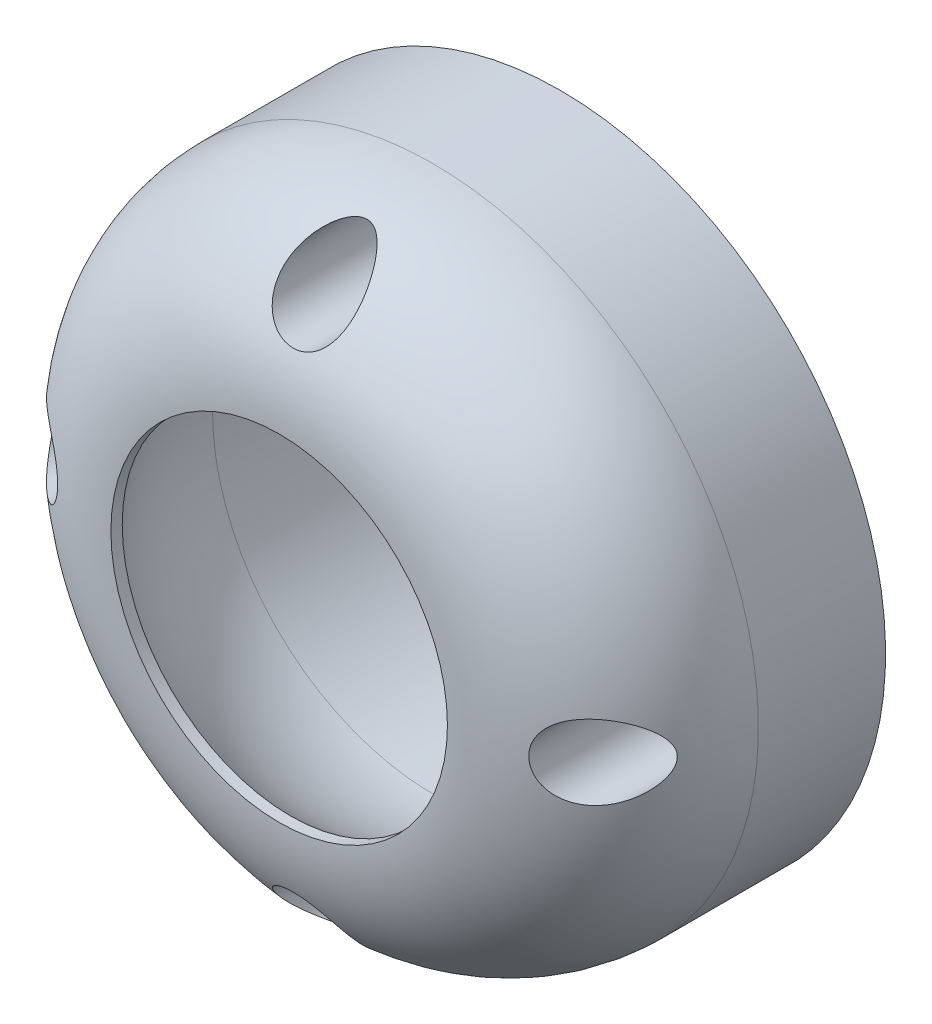
from build123d import *

# Parameters (mm, degrees)
REVOLVE_1_ANGLE     = 180
SKETCH_2_R          = 11.25
CUT_EXTRUDE_1_DEPTH = 27.413774815
SKETCH_3_R          = 21.75
SKETCH_3_R_2        = 14.75
EXTRUDE_1_DEPTH     = 8.5
SKETCH_7_R          = 1.1
CUT_EXTRUDE_2_DEPTH = 37.048238436
CUT_EXTRUDE_START   = 3
SKETCH_8_R          = 2.5
CUT_EXTRUDE_7_DEPTH = 34.048238436


with BuildPart() as part:
    # ｽｹｯﾁ1 → 回転1 (revolve)
    with BuildSketch(Plane.XY):
        with BuildLine():
            Line((-15.25, 0), (-14.75, 0))
            ThreePointArc((-14.75, 0), (0, -14.75), (14.75, 0))
            Line((14.75, 0), (15.25, 0))
            ThreePointArc((15.25, 0), (0, -15.25), (-15.25, 0))
        make_face()
    revolve(axis=Axis((14.75, 0, 0), (-1, 0, 0)), revolution_arc=REVOLVE_1_ANGLE)

    # ｽｹｯﾁ2 → ｶｯﾄ - 押し出し1 (cut, through all)
    with BuildSketch(Plane(origin=(0, 0, 0), x_dir=(-1, 0, 0), z_dir=(0, 0, -1))):
        Circle(SKETCH_2_R)
    extrude(amount=-CUT_EXTRUDE_1_DEPTH, mode=Mode.SUBTRACT)

    # ｽｹｯﾁ4 → 回転2 (revolve)
    with BuildSketch(Plane(origin=(0, 0, 0), x_dir=(0, 0, -1), z_dir=(1, 0, 0))):
        with BuildLine():
            Line((0, 15.25), (0, 21.75))
            ThreePointArc((0, 21.75), (-7.352720585, 18.661989683), (-10.295630141, 11.25))
            ThreePointArc((-10.295630141, 11.25), (-5.522680509, 14.214868976), (0, 15.25))
        make_face()
    revolve(axis=Axis((0, 0, 0), (0, 0, 1)))

    # ｽｹｯﾁ3 → ﾎﾞｽ - 押し出し1 (add)
    with BuildSketch(Plane(origin=(0, 0, 0), x_dir=(-1, 0, 0), z_dir=(0, 0, -1))):
        Circle(SKETCH_3_R)
        Circle(SKETCH_3_R_2, mode=Mode.SUBTRACT)
    extrude(amount=EXTRUDE_1_DEPTH)

    # ｽｹｯﾁ7 → ｶｯﾄ - 押し出し2 (cut, through all)
    with BuildSketch(Plane(origin=(0, 0, -8.5), x_dir=(-1, 0, 0), z_dir=(0, 0, -1))):
        with Locations((0, -18.25)):
            Circle(SKETCH_7_R)
        with Locations((-18.25, 0)):
            Circle(SKETCH_7_R)
        with Locations((0, 18.25)):
            Circle(SKETCH_7_R)
        with Locations((18.25, 0)):
            Circle(SKETCH_7_R)
    extrude(amount=-CUT_EXTRUDE_2_DEPTH, mode=Mode.SUBTRACT)

    # ｽｹｯﾁ8 → ｶｯﾄ - 押し出し7 (cut, through all)
    with BuildSketch(Plane.XY.offset(-8.5).offset(CUT_EXTRUDE_START)):
        with Locations((0, 18.25)):
            Circle(SKETCH_8_R)
        with Locations((18.25, 0)):
            Circle(SKETCH_8_R)
        with Locations((0, -18.25)):
            Circle(SKETCH_8_R)
        with Locations((-18.25, 0)):
            Circle(SKETCH_8_R)
    extrude(amount=CUT_EXTRUDE_7_DEPTH, mode=Mode.SUBTRACT)


solid = part.part
